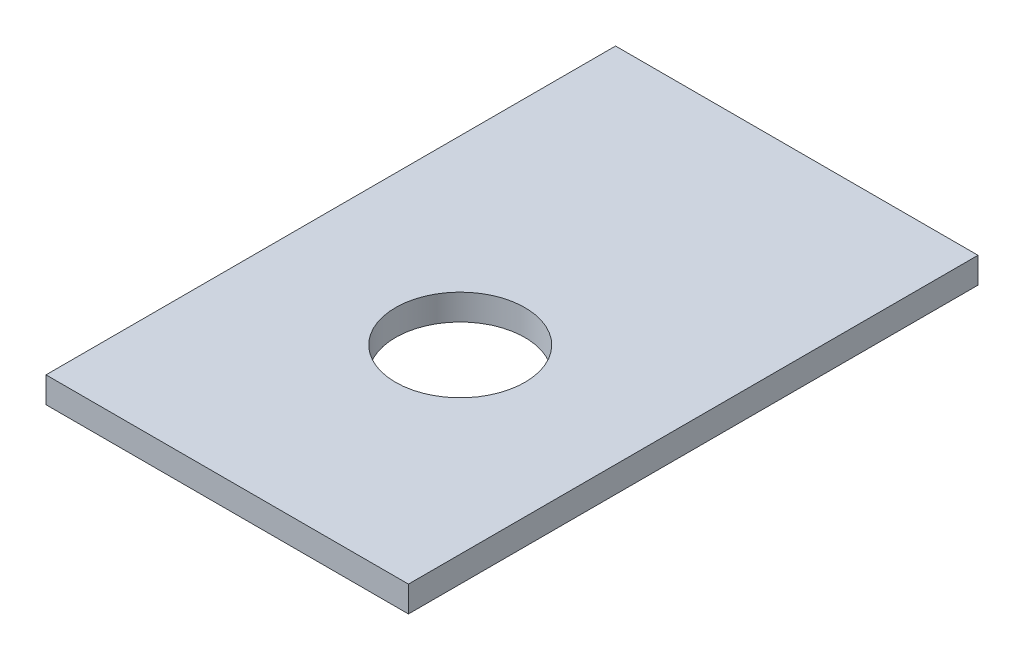
from build123d import *

# Parameters (mm, degrees)
CROQUIS1_W              = 70
CROQUIS1_H              = 110
CROQUIS1_R              = 12.5
SALIENTE_EXTRUIR1_DEPTH = 5


with BuildPart() as part:
    # Croquis1 → Saliente-Extruir1 (new body)
    with BuildSketch(Plane(origin=(0, 0, 0), x_dir=(1, 0, 0), z_dir=(0, 1, 0))):
        with Locations((5.796178344, -36.162420382)):
            Rectangle(CROQUIS1_W, CROQUIS1_H)
        with Locations((5.796178344, -46.162420382)):
            Circle(CROQUIS1_R, mode=Mode.SUBTRACT)
    extrude(amount=SALIENTE_EXTRUIR1_DEPTH)


solid = part.part
